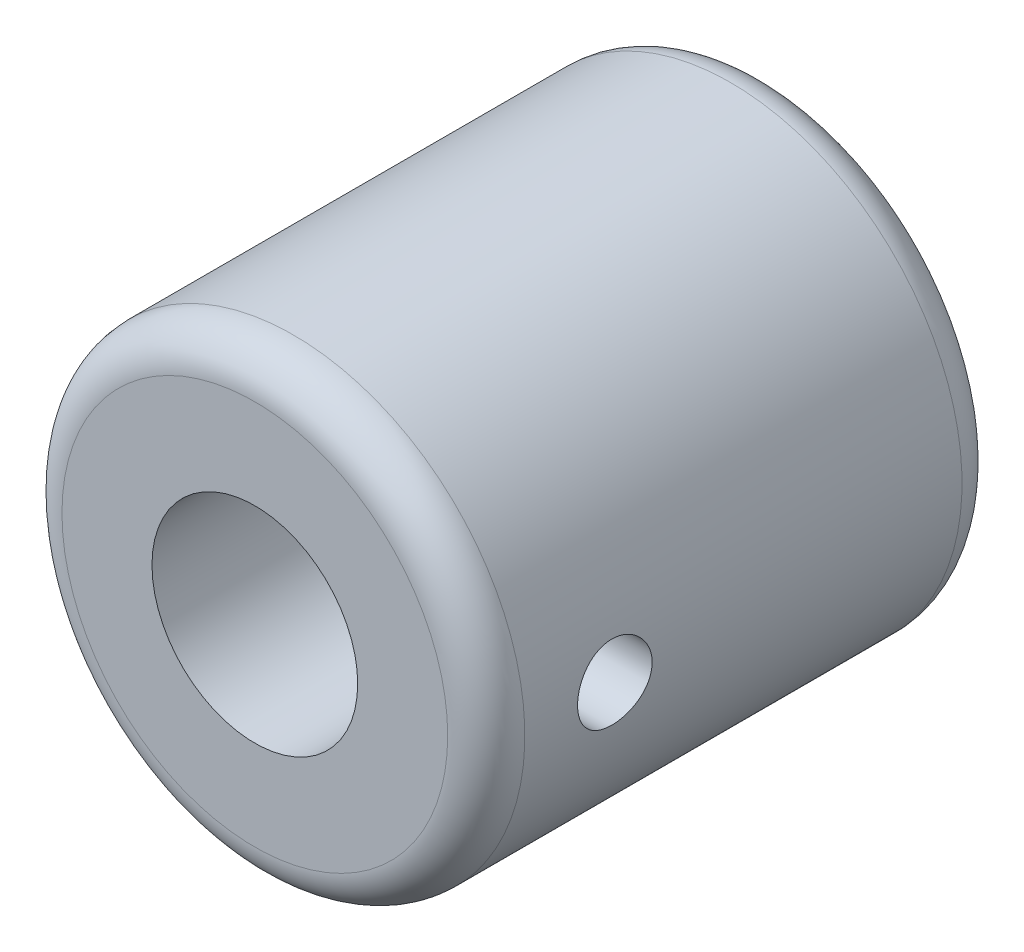
from build123d import *

# Parameters (mm, degrees)
F_8_0_8_DIAMETER_HOLE1_D     = 8
F_8_0_8_DIAMETER_HOLE1_DEPTH = 10
SKETCH4_W                    = 1.45
SKETCH4_H                    = 18


with BuildPart() as part:
    # Sketch1 → Revolve1 (revolve)
    with BuildSketch(Plane.XZ):
        with BuildLine():
            Line((7.5, 20), (0, 20))
            Line((0, 20), (0, 0))
            Line((0, 0), (7.5, 0))
            ThreePointArc((7.5, 0), (8.560660172, 0.439339828), (9, 1.5))
            Line((9, 1.5), (9, 18.5))
            ThreePointArc((9, 18.5), (8.560660172, 19.560660172), (7.5, 20))
        make_face()
    revolve(axis=Axis((0, 0, 20), (0, 0, -1)))

    # Ø8.0 (8) Diameter Hole1
    with Locations(Plane.XY.offset(20)):
        with Locations((0, 0)):
            Hole(F_8_0_8_DIAMETER_HOLE1_D / 2, depth=F_8_0_8_DIAMETER_HOLE1_DEPTH)

    # Sketch4 → Ø2.9 (2.9) Diameter Hole1 (revolve, cut)
    with BuildSketch(Plane(origin=(3.727935085, 0, 15), x_dir=(0, 0, 1), z_dir=(0, 1, 0))):
        with Locations((0.725, 9)):
            Rectangle(SKETCH4_W, SKETCH4_H)
    revolve(axis=Axis((-2.622064915, 0, 15), (1, 0, 0)), mode=Mode.SUBTRACT)


solid = part.part
